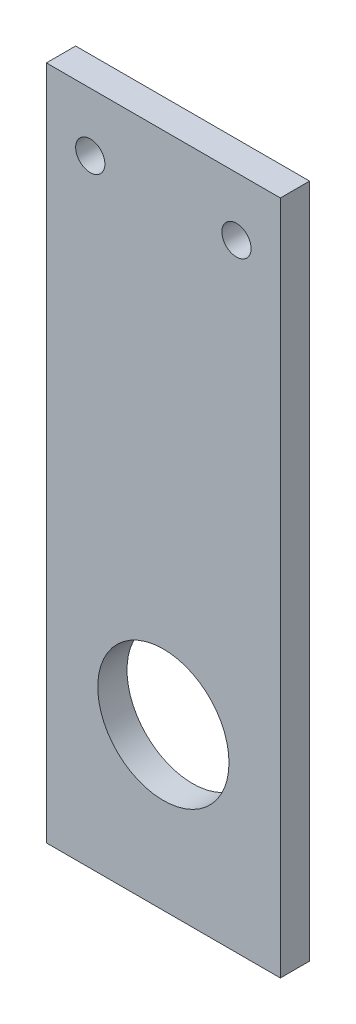
from build123d import *

# Parameters (mm, degrees)
SKETCH1_W           = 50.8
SKETCH1_H           = 146.685
SKETCH1_R           = 14.2494
SKETCH1_R_2         = 3.175
BOSS_EXTRUDE3_DEPTH = 6.35


with BuildPart() as part:
    # Sketch1 → Boss-Extrude3 (new body)
    with BuildSketch(Plane.XY):
        with Locations((0, -73.3425)):
            Rectangle(SKETCH1_W, SKETCH1_H)
        with Locations((0, -111.76)):
            Circle(SKETCH1_R, mode=Mode.SUBTRACT)
        with Locations((-15.875, -12.7)):
            Circle(SKETCH1_R_2, mode=Mode.SUBTRACT)
        with Locations((15.875, -12.7)):
            Circle(SKETCH1_R_2, mode=Mode.SUBTRACT)
    extrude(amount=BOSS_EXTRUDE3_DEPTH)


solid = part.part
